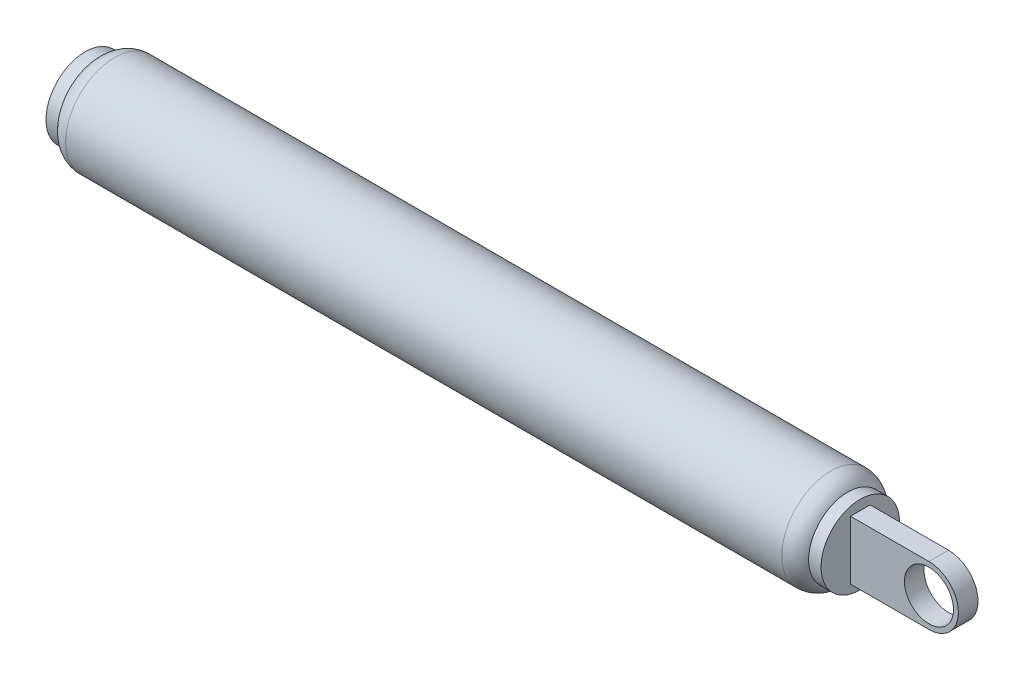
from build123d import *

# Parameters (mm, degrees)
BOSS_EXTRUDE1_DEPTH          = 2
F_6_0_6_DIAMETER_HOLE1_D     = 6
F_6_0_6_DIAMETER_HOLE1_DEPTH = 25
F_5_0_5_DIAMETER_HOLE1_D     = 5
F_5_0_5_DIAMETER_HOLE1_DEPTH = 6


with BuildPart() as part:
    # Sketch1 → Revolve1 (revolve)
    with BuildSketch(Plane(origin=(0, 0, 0), x_dir=(-1, 0, 0), z_dir=(0, 0, -1))):
        with BuildLine():
            Line((-39.5, 4), (-39.5, 0))
            Line((-39.5, 0), (39.5, 0))
            Line((39.5, 0), (39.5, 4))
            Line((39.5, 4), (38.232050808, 4))
            ThreePointArc((38.232050808, 4), (37.5, 4.732050808), (36.5, 5))
            Line((36.5, 5), (-36.5, 5))
            ThreePointArc((-36.5, 5), (-37.5, 4.732050808), (-38.232050808, 4))
            Line((-38.232050808, 4), (-39.5, 4))
        make_face()
    revolve(axis=Axis((39.5, 0, 0), (-1, 0, 0)))

    # Sketch2 → Boss-Extrude1 (add)
    with BuildSketch(Plane.XY.offset(1)):
        with BuildLine():
            Line((47.5, 3), (39.5, 3))
            Line((39.5, 3), (39.5, -3))
            Line((39.5, -3), (47.5, -3))
            ThreePointArc((47.5, -3), (50.5, 0), (47.5, 3))
        make_face()
    extrude(amount=-BOSS_EXTRUDE1_DEPTH)

    # Ø6.0 (6) Diameter Hole1
    with Locations(Plane.ZY.offset(39.5)):
        with Locations((0, 0)):
            Hole(F_6_0_6_DIAMETER_HOLE1_D / 2, depth=F_6_0_6_DIAMETER_HOLE1_DEPTH)

    # Ø5.0 (5) Diameter Hole1
    with Locations(Plane(origin=(0, 0, -1), x_dir=(-1, 0, 0), z_dir=(0, 0, -1))):
        with Locations((-47.5, 0)):
            Hole(F_5_0_5_DIAMETER_HOLE1_D / 2, depth=F_5_0_5_DIAMETER_HOLE1_DEPTH)


solid = part.part
